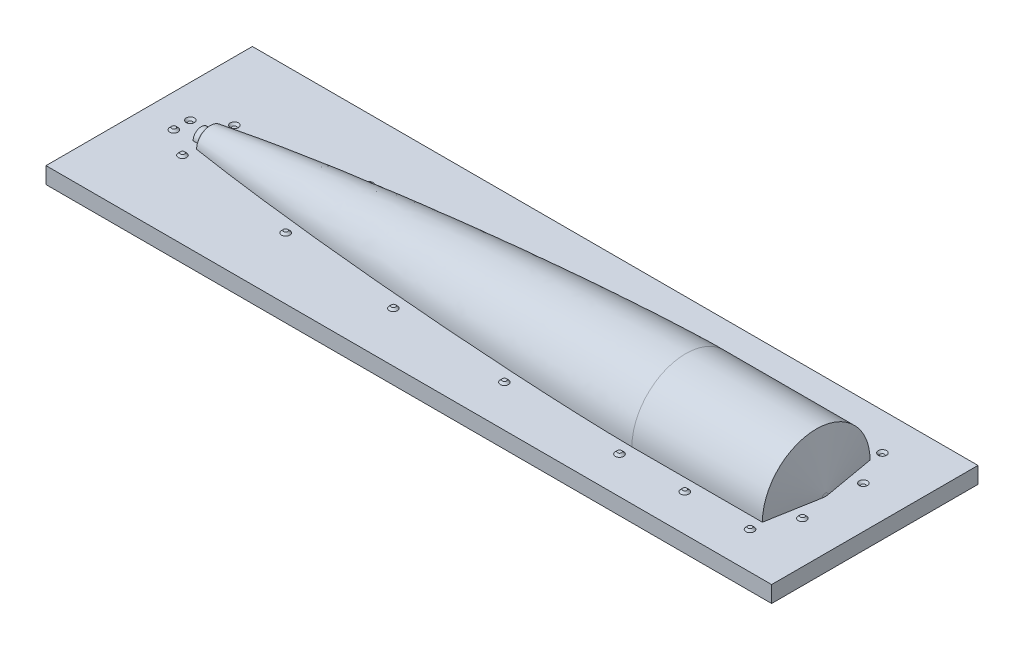
from build123d import *

# Parameters (mm, degrees)
MAIN_BODY_ANGLE               = 180
SCALE1_SCALE                  = 0.991965
SKETCH2_W                     = 1120.579411349
SKETCH2_H                     = 318.693010092
BOSS_EXTRUDE1_DEPTH           = 25.4
FILLET1_R                     = 6.35
SKETCH3_R                     = 6.35
BOSS_EXTRUDE2_DEPTH           = 3.175
BOSS_EXTRUDE2_DRAFT           = 45
BOSS_EXTRUDE2_PROFILE_2_DEPTH = 3.175
BOSS_EXTRUDE2_PROFILE_2_DRAFT = 45
BOSS_EXTRUDE2_PROFILE_3_DEPTH = 3.175
BOSS_EXTRUDE2_PROFILE_3_DRAFT = 45
BOSS_EXTRUDE2_PROFILE_4_DEPTH = 3.175
BOSS_EXTRUDE2_PROFILE_4_DRAFT = 45
BOSS_EXTRUDE2_PROFILE_5_DEPTH = 3.175
BOSS_EXTRUDE2_PROFILE_5_DRAFT = 45
BOSS_EXTRUDE2_PROFILE_6_DEPTH = 3.175
BOSS_EXTRUDE2_PROFILE_6_DRAFT = 45
BOSS_EXTRUDE2_PROFILE_7_DEPTH = 3.175
BOSS_EXTRUDE2_PROFILE_7_DRAFT = 45
BOSS_EXTRUDE2_PROFILE_8_DEPTH = 3.175
BOSS_EXTRUDE2_PROFILE_8_DRAFT = 45
BOSS_EXTRUDE2_PROFILE_9_DEPTH = 3.175
BOSS_EXTRUDE2_PROFILE_9_DRAFT = 45
SKETCH4_R                     = 6.35
CUT_EXTRUDE1_DEPTH            = 3.175
CUT_EXTRUDE1_DRAFT            = -45
CUT_EXTRUDE1_PROFILE_2_DEPTH  = 3.175
CUT_EXTRUDE1_PROFILE_2_DRAFT  = -45
CUT_EXTRUDE1_PROFILE_3_DEPTH  = 3.175
CUT_EXTRUDE1_PROFILE_3_DRAFT  = -45
CUT_EXTRUDE1_PROFILE_4_DEPTH  = 3.175
CUT_EXTRUDE1_PROFILE_4_DRAFT  = -45
CUT_EXTRUDE1_PROFILE_5_DEPTH  = 3.175
CUT_EXTRUDE1_PROFILE_5_DRAFT  = -45
CUT_EXTRUDE1_PROFILE_6_DEPTH  = 3.175
CUT_EXTRUDE1_PROFILE_6_DRAFT  = -45
CUT_EXTRUDE1_PROFILE_7_DEPTH  = 3.175
CUT_EXTRUDE1_PROFILE_7_DRAFT  = -45
CUT_EXTRUDE1_PROFILE_8_DEPTH  = 3.175
CUT_EXTRUDE1_PROFILE_8_DRAFT  = -45
CUT_EXTRUDE1_PROFILE_9_DEPTH  = 3.175
CUT_EXTRUDE1_PROFILE_9_DRAFT  = -45


with BuildPart() as part:
    # Sketch1 → main body (revolve)
    with BuildSketch(Plane(origin=(0, 0, 0), x_dir=(1, 0, 0), z_dir=(0, 1, 0))):
        with BuildLine():
            Line((838.2, 83.82), (1041.4, 83.82))
            Line((1041.4, 83.82), (1055.402008508, 4.410663713))
            ThreePointArc((1055.402008508, 4.410663713), (1055.691236913, 2.213755866), (1055.787891581, 0))
            Line((1055.787891581, 0), (79.766145502, 0))
            ThreePointArc((79.766145502, 0), (80.010172441, 2.47764709), (80.732875439, 4.860079591))
            Line((80.732875439, 4.860079591), (83.9802768, 12.7))
            Line((83.9802768, 12.7), (96.6802768, 12.7))
            Line((96.6802768, 12.7), (98.225852671, 21.465396338))
            add(Edge.make_bspline(
                [(98.225852671, 21.465396338), (104.654328606, 22.492721153), (123.887764391, 25.486366873), (155.972005609, 30.143094939), (200.955569884, 36.09512031), (252.401811828, 42.306208001), (303.904445896, 48.029958479), (355.452205043, 53.329785664), (407.038239325, 58.242919226), (458.657507181, 62.792777027), (510.306645018, 66.990091608), (561.983121891, 70.836146847), (613.685225833, 74.321423415), (665.41176163, 77.424229696), (710.69328025, 79.769183333), (749.520737416, 81.469924508), (780.831685961, 82.59702331), (801.909844263, 83.213680173), (819.226063658, 83.60070134), (830.067937057, 83.761787884), (835.489248896, 83.813215153), (838.2, 83.82)],
                knots=[0.119456002, 0.119456002, 0.119456002, 0.119456002, 0.119456002, 0.150314205, 0.211721038, 0.273127872, 0.334534706, 0.395941541, 0.457348376, 0.518755211, 0.580162046, 0.641568881, 0.702975716, 0.764382551, 0.825789386, 0.887196222, 0.917899639, 0.948603057, 0.974301528, 0.987150764, 1, 1, 1, 1, 1], degree=4))
        make_face()
    revolve(axis=Axis((1055.787891581, 0, 0), (1, 0, 0)), revolution_arc=MAIN_BODY_ANGLE)


with BuildPart() as part_1:
    # Scale1: scaled about (699.983015621, 31.460824761, 0)
    add(part.part.scale(SCALE1_SCALE).moved(Location((5.624363531, 0.252787727, 0))))

    # Sketch2 → Boss-Extrude1 (add)
    with BuildSketch(Plane.XZ.offset(-0.252816581)):
        with Locations((568.839409645, 0)):
            Rectangle(SKETCH2_W, SKETCH2_H)
    extrude(amount=BOSS_EXTRUDE1_DEPTH)

    # Fillet1
    fillet1_edges = [part_1.edges().sort_by_distance(p)[0] for p in [
        (101.527814307, 12.850743227, 0),
    ]]
    fillet(fillet1_edges, radius=FILLET1_R)


with BuildPart() as boss_extrude2_tool:
    # Sketch3 → Boss-Extrude2 (with draft: the straight prism first)
    with BuildSketch(Plane(origin=(0, 0.252816581, 0), x_dir=(1, 0, 0), z_dir=(0, 1, 0))):
        with Locations((1038.656830447, -102.196507554)):
            Circle(SKETCH3_R)
    extrude(amount=BOSS_EXTRUDE2_DEPTH)
    # Boss-Extrude2: the draft: its side faces are tilted about the plane it starts from
    boss_extrude2_sides = [boss_extrude2_tool.faces().sort_by_distance(p)[0] for p in [
        (1032.306830447, 1.840316581, 102.196507554),
    ]]
    draft(boss_extrude2_sides, Plane(origin=(0, 0.252816581, 0), x_dir=(1, 0, 0), z_dir=(0, 1, 0)), BOSS_EXTRUDE2_DRAFT)


with BuildPart() as part_2:
    add(part_1.part)

    # Boss-Extrude2: add boss_extrude2_tool
    add(boss_extrude2_tool.part)


with BuildPart() as boss_extrude2_profile_2_tool:
    # Sketch3 → Boss-Extrude2 profile 2 (with draft: the straight prism first)
    with BuildSketch(Plane(origin=(0, 0.252816581, 0), x_dir=(1, 0, 0), z_dir=(0, 1, 0))):
        with Locations((837.041861591, -102.196447883)):
            Circle(SKETCH3_R)
    extrude(amount=BOSS_EXTRUDE2_PROFILE_2_DEPTH)
    # Boss-Extrude2 profile 2: the draft: its side faces are tilted about the plane it starts from
    boss_extrude2_profile_2_sides = [boss_extrude2_profile_2_tool.faces().sort_by_distance(p)[0] for p in [
        (830.691861591, 1.840316581, 102.196447883),
    ]]
    draft(boss_extrude2_profile_2_sides, Plane(origin=(0, 0.252816581, 0), x_dir=(1, 0, 0), z_dir=(0, 1, 0)), BOSS_EXTRUDE2_PROFILE_2_DRAFT)


with BuildPart() as part_3:
    add(part_2.part)

    # Boss-Extrude2 profile 2: add boss_extrude2_profile_2_tool
    add(boss_extrude2_profile_2_tool.part)


with BuildPart() as boss_extrude2_profile_3_tool:
    # Sketch3 → Boss-Extrude2 profile 3 (with draft: the straight prism first)
    with BuildSketch(Plane(origin=(0, 0.252816581, 0), x_dir=(1, 0, 0), z_dir=(0, 1, 0))):
        with Locations((100.054881646, -40.104228961)):
            Circle(SKETCH3_R)
    extrude(amount=BOSS_EXTRUDE2_PROFILE_3_DEPTH)
    # Boss-Extrude2 profile 3: the draft: its side faces are tilted about the plane it starts from
    boss_extrude2_profile_3_sides = [boss_extrude2_profile_3_tool.faces().sort_by_distance(p)[0] for p in [
        (93.704881646, 1.840316581, 40.104228961),
    ]]
    draft(boss_extrude2_profile_3_sides, Plane(origin=(0, 0.252816581, 0), x_dir=(1, 0, 0), z_dir=(0, 1, 0)), BOSS_EXTRUDE2_PROFILE_3_DRAFT)


with BuildPart() as part_4:
    add(part_3.part)

    # Boss-Extrude2 profile 3: add boss_extrude2_profile_3_tool
    add(boss_extrude2_profile_3_tool.part)


with BuildPart() as boss_extrude2_profile_4_tool:
    # Sketch3 → Boss-Extrude2 profile 4 (with draft: the straight prism first)
    with BuildSketch(Plane(origin=(0, 0.252816581, 0), x_dir=(1, 0, 0), z_dir=(0, 1, 0))):
        with Locations((467.637563034, -81.924467626)):
            Circle(SKETCH3_R)
    extrude(amount=BOSS_EXTRUDE2_PROFILE_4_DEPTH)
    # Boss-Extrude2 profile 4: the draft: its side faces are tilted about the plane it starts from
    boss_extrude2_profile_4_sides = [boss_extrude2_profile_4_tool.faces().sort_by_distance(p)[0] for p in [
        (461.287563034, 1.840316581, 81.924467626),
    ]]
    draft(boss_extrude2_profile_4_sides, Plane(origin=(0, 0.252816581, 0), x_dir=(1, 0, 0), z_dir=(0, 1, 0)), BOSS_EXTRUDE2_PROFILE_4_DRAFT)


with BuildPart() as part_5:
    add(part_4.part)

    # Boss-Extrude2 profile 4: add boss_extrude2_profile_4_tool
    add(boss_extrude2_profile_4_tool.part)


with BuildPart() as boss_extrude2_profile_5_tool:
    # Sketch3 → Boss-Extrude2 profile 5 (with draft: the straight prism first)
    with BuildSketch(Plane(origin=(0, 0.252816581, 0), x_dir=(1, 0, 0), z_dir=(0, 1, 0))):
        with Locations((283.489465999, -64.150089659)):
            Circle(SKETCH3_R)
    extrude(amount=BOSS_EXTRUDE2_PROFILE_5_DEPTH)
    # Boss-Extrude2 profile 5: the draft: its side faces are tilted about the plane it starts from
    boss_extrude2_profile_5_sides = [boss_extrude2_profile_5_tool.faces().sort_by_distance(p)[0] for p in [
        (277.139465999, 1.840316581, 64.150089659),
    ]]
    draft(boss_extrude2_profile_5_sides, Plane(origin=(0, 0.252816581, 0), x_dir=(1, 0, 0), z_dir=(0, 1, 0)), BOSS_EXTRUDE2_PROFILE_5_DRAFT)


with BuildPart() as part_6:
    add(part_5.part)

    # Boss-Extrude2 profile 5: add boss_extrude2_profile_5_tool
    add(boss_extrude2_profile_5_tool.part)


with BuildPart() as boss_extrude2_profile_6_tool:
    # Sketch3 → Boss-Extrude2 profile 6 (with draft: the straight prism first)
    with BuildSketch(Plane(origin=(0, 0.252816581, 0), x_dir=(1, 0, 0), z_dir=(0, 1, 0))):
        with Locations((652.17690639, -95.027173729)):
            Circle(SKETCH3_R)
    extrude(amount=BOSS_EXTRUDE2_PROFILE_6_DEPTH)
    # Boss-Extrude2 profile 6: the draft: its side faces are tilted about the plane it starts from
    boss_extrude2_profile_6_sides = [boss_extrude2_profile_6_tool.faces().sort_by_distance(p)[0] for p in [
        (645.82690639, 1.840316581, 95.027173729),
    ]]
    draft(boss_extrude2_profile_6_sides, Plane(origin=(0, 0.252816581, 0), x_dir=(1, 0, 0), z_dir=(0, 1, 0)), BOSS_EXTRUDE2_PROFILE_6_DRAFT)


with BuildPart() as part_7:
    add(part_6.part)

    # Boss-Extrude2 profile 6: add boss_extrude2_profile_6_tool
    add(boss_extrude2_profile_6_tool.part)


with BuildPart() as boss_extrude2_profile_7_tool:
    # Sketch3 → Boss-Extrude2 profile 7 (with draft: the straight prism first)
    with BuildSketch(Plane(origin=(0, 0.252816581, 0), x_dir=(1, 0, 0), z_dir=(0, 1, 0))):
        with Locations((59.34970397, -12.7)):
            Circle(SKETCH3_R)
    extrude(amount=BOSS_EXTRUDE2_PROFILE_7_DEPTH)
    # Boss-Extrude2 profile 7: the draft: its side faces are tilted about the plane it starts from
    boss_extrude2_profile_7_sides = [boss_extrude2_profile_7_tool.faces().sort_by_distance(p)[0] for p in [
        (52.99970397, 1.840316581, 12.7),
    ]]
    draft(boss_extrude2_profile_7_sides, Plane(origin=(0, 0.252816581, 0), x_dir=(1, 0, 0), z_dir=(0, 1, 0)), BOSS_EXTRUDE2_PROFILE_7_DRAFT)


with BuildPart() as part_8:
    add(part_7.part)

    # Boss-Extrude2 profile 7: add boss_extrude2_profile_7_tool
    add(boss_extrude2_profile_7_tool.part)


with BuildPart() as boss_extrude2_profile_8_tool:
    # Sketch3 → Boss-Extrude2 profile 8 (with draft: the straight prism first)
    with BuildSketch(Plane(origin=(0, 0.252816581, 0), x_dir=(1, 0, 0), z_dir=(0, 1, 0))):
        with Locations((1064.362169326, -47.068864203)):
            Circle(SKETCH3_R)
    extrude(amount=BOSS_EXTRUDE2_PROFILE_8_DEPTH)
    # Boss-Extrude2 profile 8: the draft: its side faces are tilted about the plane it starts from
    boss_extrude2_profile_8_sides = [boss_extrude2_profile_8_tool.faces().sort_by_distance(p)[0] for p in [
        (1058.012169326, 1.840316581, 47.068864203),
    ]]
    draft(boss_extrude2_profile_8_sides, Plane(origin=(0, 0.252816581, 0), x_dir=(1, 0, 0), z_dir=(0, 1, 0)), BOSS_EXTRUDE2_PROFILE_8_DRAFT)


with BuildPart() as part_9:
    add(part_8.part)

    # Boss-Extrude2 profile 8: add boss_extrude2_profile_8_tool
    add(boss_extrude2_profile_8_tool.part)


with BuildPart() as boss_extrude2_profile_9_tool:
    # Sketch3 → Boss-Extrude2 profile 9 (with draft: the straight prism first)
    with BuildSketch(Plane(origin=(0, 0.252816581, 0), x_dir=(1, 0, 0), z_dir=(0, 1, 0))):
        with Locations((937.873186447, -102.196507554)):
            Circle(SKETCH3_R)
    extrude(amount=BOSS_EXTRUDE2_PROFILE_9_DEPTH)
    # Boss-Extrude2 profile 9: the draft: its side faces are tilted about the plane it starts from
    boss_extrude2_profile_9_sides = [boss_extrude2_profile_9_tool.faces().sort_by_distance(p)[0] for p in [
        (931.523186447, 1.840316581, 102.196507554),
    ]]
    draft(boss_extrude2_profile_9_sides, Plane(origin=(0, 0.252816581, 0), x_dir=(1, 0, 0), z_dir=(0, 1, 0)), BOSS_EXTRUDE2_PROFILE_9_DRAFT)


with BuildPart() as part_10:
    add(part_9.part)

    # Boss-Extrude2 profile 9: add boss_extrude2_profile_9_tool
    add(boss_extrude2_profile_9_tool.part)


with BuildPart() as cut_extrude1_tool:
    # Sketch4 → Cut-Extrude1 (with draft: the straight prism first)
    with BuildSketch(Plane(origin=(0, 0.252816581, 0), x_dir=(1, 0, 0), z_dir=(0, 1, 0))):
        with Locations((1038.656830447, 102.196507554)):
            Circle(SKETCH4_R)
    extrude(amount=-CUT_EXTRUDE1_DEPTH)
    # Cut-Extrude1: the draft: its side faces are tilted about the plane it starts from
    cut_extrude1_sides = [cut_extrude1_tool.faces().sort_by_distance(p)[0] for p in [
        (1032.306830447, -1.334683419, -102.196507554),
    ]]
    draft(cut_extrude1_sides, Plane(origin=(0, 0.252816581, 0), x_dir=(1, 0, 0), z_dir=(0, 1, 0)), CUT_EXTRUDE1_DRAFT)


with BuildPart() as part_11:
    add(part_10.part)

    # Cut-Extrude1: cut by cut_extrude1_tool
    add(cut_extrude1_tool.part, mode=Mode.SUBTRACT)


with BuildPart() as cut_extrude1_profile_2_tool:
    # Sketch4 → Cut-Extrude1 profile 2 (with draft: the straight prism first)
    with BuildSketch(Plane(origin=(0, 0.252816581, 0), x_dir=(1, 0, 0), z_dir=(0, 1, 0))):
        with Locations((837.041861591, 102.196447883)):
            Circle(SKETCH4_R)
    extrude(amount=-CUT_EXTRUDE1_PROFILE_2_DEPTH)
    # Cut-Extrude1 profile 2: the draft: its side faces are tilted about the plane it starts from
    cut_extrude1_profile_2_sides = [cut_extrude1_profile_2_tool.faces().sort_by_distance(p)[0] for p in [
        (830.691861591, -1.334683419, -102.196447883),
    ]]
    draft(cut_extrude1_profile_2_sides, Plane(origin=(0, 0.252816581, 0), x_dir=(1, 0, 0), z_dir=(0, 1, 0)), CUT_EXTRUDE1_PROFILE_2_DRAFT)


with BuildPart() as part_12:
    add(part_11.part)

    # Cut-Extrude1 profile 2: cut by cut_extrude1_profile_2_tool
    add(cut_extrude1_profile_2_tool.part, mode=Mode.SUBTRACT)


with BuildPart() as cut_extrude1_profile_3_tool:
    # Sketch4 → Cut-Extrude1 profile 3 (with draft: the straight prism first)
    with BuildSketch(Plane(origin=(0, 0.252816581, 0), x_dir=(1, 0, 0), z_dir=(0, 1, 0))):
        with Locations((100.054881646, 40.104228961)):
            Circle(SKETCH4_R)
    extrude(amount=-CUT_EXTRUDE1_PROFILE_3_DEPTH)
    # Cut-Extrude1 profile 3: the draft: its side faces are tilted about the plane it starts from
    cut_extrude1_profile_3_sides = [cut_extrude1_profile_3_tool.faces().sort_by_distance(p)[0] for p in [
        (93.704881646, -1.334683419, -40.104228961),
    ]]
    draft(cut_extrude1_profile_3_sides, Plane(origin=(0, 0.252816581, 0), x_dir=(1, 0, 0), z_dir=(0, 1, 0)), CUT_EXTRUDE1_PROFILE_3_DRAFT)


with BuildPart() as part_13:
    add(part_12.part)

    # Cut-Extrude1 profile 3: cut by cut_extrude1_profile_3_tool
    add(cut_extrude1_profile_3_tool.part, mode=Mode.SUBTRACT)


with BuildPart() as cut_extrude1_profile_4_tool:
    # Sketch4 → Cut-Extrude1 profile 4 (with draft: the straight prism first)
    with BuildSketch(Plane(origin=(0, 0.252816581, 0), x_dir=(1, 0, 0), z_dir=(0, 1, 0))):
        with Locations((467.637563034, 81.924467626)):
            Circle(SKETCH4_R)
    extrude(amount=-CUT_EXTRUDE1_PROFILE_4_DEPTH)
    # Cut-Extrude1 profile 4: the draft: its side faces are tilted about the plane it starts from
    cut_extrude1_profile_4_sides = [cut_extrude1_profile_4_tool.faces().sort_by_distance(p)[0] for p in [
        (461.287563034, -1.334683419, -81.924467626),
    ]]
    draft(cut_extrude1_profile_4_sides, Plane(origin=(0, 0.252816581, 0), x_dir=(1, 0, 0), z_dir=(0, 1, 0)), CUT_EXTRUDE1_PROFILE_4_DRAFT)


with BuildPart() as part_14:
    add(part_13.part)

    # Cut-Extrude1 profile 4: cut by cut_extrude1_profile_4_tool
    add(cut_extrude1_profile_4_tool.part, mode=Mode.SUBTRACT)


with BuildPart() as cut_extrude1_profile_5_tool:
    # Sketch4 → Cut-Extrude1 profile 5 (with draft: the straight prism first)
    with BuildSketch(Plane(origin=(0, 0.252816581, 0), x_dir=(1, 0, 0), z_dir=(0, 1, 0))):
        with Locations((283.489465999, 64.150089659)):
            Circle(SKETCH4_R)
    extrude(amount=-CUT_EXTRUDE1_PROFILE_5_DEPTH)
    # Cut-Extrude1 profile 5: the draft: its side faces are tilted about the plane it starts from
    cut_extrude1_profile_5_sides = [cut_extrude1_profile_5_tool.faces().sort_by_distance(p)[0] for p in [
        (277.139465999, -1.334683419, -64.150089659),
    ]]
    draft(cut_extrude1_profile_5_sides, Plane(origin=(0, 0.252816581, 0), x_dir=(1, 0, 0), z_dir=(0, 1, 0)), CUT_EXTRUDE1_PROFILE_5_DRAFT)


with BuildPart() as part_15:
    add(part_14.part)

    # Cut-Extrude1 profile 5: cut by cut_extrude1_profile_5_tool
    add(cut_extrude1_profile_5_tool.part, mode=Mode.SUBTRACT)


with BuildPart() as cut_extrude1_profile_6_tool:
    # Sketch4 → Cut-Extrude1 profile 6 (with draft: the straight prism first)
    with BuildSketch(Plane(origin=(0, 0.252816581, 0), x_dir=(1, 0, 0), z_dir=(0, 1, 0))):
        with Locations((652.17690639, 95.027173729)):
            Circle(SKETCH4_R)
    extrude(amount=-CUT_EXTRUDE1_PROFILE_6_DEPTH)
    # Cut-Extrude1 profile 6: the draft: its side faces are tilted about the plane it starts from
    cut_extrude1_profile_6_sides = [cut_extrude1_profile_6_tool.faces().sort_by_distance(p)[0] for p in [
        (645.82690639, -1.334683419, -95.027173729),
    ]]
    draft(cut_extrude1_profile_6_sides, Plane(origin=(0, 0.252816581, 0), x_dir=(1, 0, 0), z_dir=(0, 1, 0)), CUT_EXTRUDE1_PROFILE_6_DRAFT)


with BuildPart() as part_16:
    add(part_15.part)

    # Cut-Extrude1 profile 6: cut by cut_extrude1_profile_6_tool
    add(cut_extrude1_profile_6_tool.part, mode=Mode.SUBTRACT)


with BuildPart() as cut_extrude1_profile_7_tool:
    # Sketch4 → Cut-Extrude1 profile 7 (with draft: the straight prism first)
    with BuildSketch(Plane(origin=(0, 0.252816581, 0), x_dir=(1, 0, 0), z_dir=(0, 1, 0))):
        with Locations((59.34970397, 12.7)):
            Circle(SKETCH4_R)
    extrude(amount=-CUT_EXTRUDE1_PROFILE_7_DEPTH)
    # Cut-Extrude1 profile 7: the draft: its side faces are tilted about the plane it starts from
    cut_extrude1_profile_7_sides = [cut_extrude1_profile_7_tool.faces().sort_by_distance(p)[0] for p in [
        (52.99970397, -1.334683419, -12.7),
    ]]
    draft(cut_extrude1_profile_7_sides, Plane(origin=(0, 0.252816581, 0), x_dir=(1, 0, 0), z_dir=(0, 1, 0)), CUT_EXTRUDE1_PROFILE_7_DRAFT)


with BuildPart() as part_17:
    add(part_16.part)

    # Cut-Extrude1 profile 7: cut by cut_extrude1_profile_7_tool
    add(cut_extrude1_profile_7_tool.part, mode=Mode.SUBTRACT)


with BuildPart() as cut_extrude1_profile_8_tool:
    # Sketch4 → Cut-Extrude1 profile 8 (with draft: the straight prism first)
    with BuildSketch(Plane(origin=(0, 0.252816581, 0), x_dir=(1, 0, 0), z_dir=(0, 1, 0))):
        with Locations((1064.362169326, 47.068864203)):
            Circle(SKETCH4_R)
    extrude(amount=-CUT_EXTRUDE1_PROFILE_8_DEPTH)
    # Cut-Extrude1 profile 8: the draft: its side faces are tilted about the plane it starts from
    cut_extrude1_profile_8_sides = [cut_extrude1_profile_8_tool.faces().sort_by_distance(p)[0] for p in [
        (1058.012169326, -1.334683419, -47.068864203),
    ]]
    draft(cut_extrude1_profile_8_sides, Plane(origin=(0, 0.252816581, 0), x_dir=(1, 0, 0), z_dir=(0, 1, 0)), CUT_EXTRUDE1_PROFILE_8_DRAFT)


with BuildPart() as part_18:
    add(part_17.part)

    # Cut-Extrude1 profile 8: cut by cut_extrude1_profile_8_tool
    add(cut_extrude1_profile_8_tool.part, mode=Mode.SUBTRACT)


with BuildPart() as cut_extrude1_profile_9_tool:
    # Sketch4 → Cut-Extrude1 profile 9 (with draft: the straight prism first)
    with BuildSketch(Plane(origin=(0, 0.252816581, 0), x_dir=(1, 0, 0), z_dir=(0, 1, 0))):
        with Locations((937.873186447, 102.196507554)):
            Circle(SKETCH4_R)
    extrude(amount=-CUT_EXTRUDE1_PROFILE_9_DEPTH)
    # Cut-Extrude1 profile 9: the draft: its side faces are tilted about the plane it starts from
    cut_extrude1_profile_9_sides = [cut_extrude1_profile_9_tool.faces().sort_by_distance(p)[0] for p in [
        (931.523186447, -1.334683419, -102.196507554),
    ]]
    draft(cut_extrude1_profile_9_sides, Plane(origin=(0, 0.252816581, 0), x_dir=(1, 0, 0), z_dir=(0, 1, 0)), CUT_EXTRUDE1_PROFILE_9_DRAFT)


with BuildPart() as part_19:
    add(part_18.part)

    # Cut-Extrude1 profile 9: cut by cut_extrude1_profile_9_tool
    add(cut_extrude1_profile_9_tool.part, mode=Mode.SUBTRACT)


solid = part_19.part
